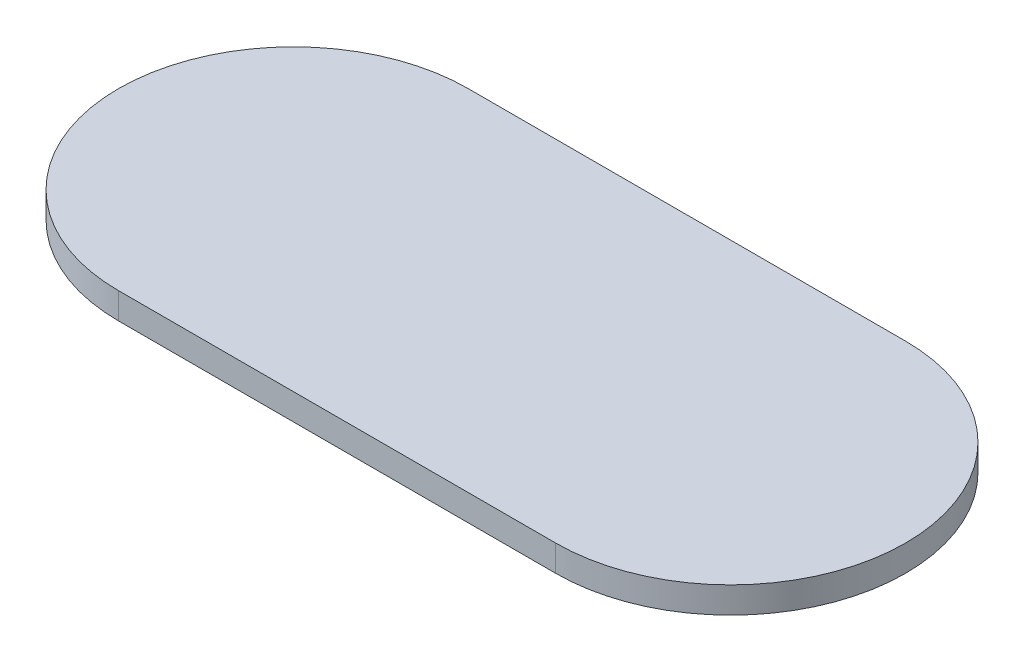
from build123d import *

# Parameters (mm, degrees)
BOSS_EXTRUDE1_DEPTH = 3.81


with BuildPart() as part:
    # Sketch1 → Boss-Extrude1 (new body)
    with BuildSketch(Plane(origin=(0, 0, 0), x_dir=(1, 0, 0), z_dir=(0, 1, 0))):
        with BuildLine():
            Line((-31.75, -25.4), (31.75, -25.4))
            ThreePointArc((31.75, -25.4), (57.15, 0), (31.75, 25.4))
            Line((31.75, 25.4), (-31.75, 25.4))
            ThreePointArc((-31.75, 25.4), (-57.15, 0), (-31.75, -25.4))
        make_face()
    extrude(amount=BOSS_EXTRUDE1_DEPTH)


solid = part.part
